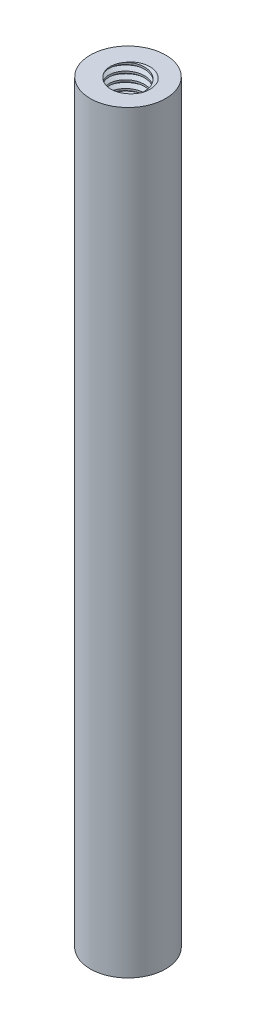
from build123d import *

# Parameters (mm, degrees)
SKETCH1_R           = 3.5
BOSS_EXTRUDE1_DEPTH = 35
SKETCH2_R           = 1.65
CUT_EXTRUDE1_DEPTH  = 6.5
THREAD1_PITCH       = 0.7
THREAD2_PITCH       = 0.7


with BuildPart() as part:
    # Sketch1 → Boss-Extrude1 (new, symmetric)
    with BuildSketch(Plane(origin=(0, 0, 0), x_dir=(1, 0, 0), z_dir=(0, 1, 0))):
        with Locations(Location((0, 0, 0), (0, 0, 270))):
            Circle(SKETCH1_R)
    extrude(amount=BOSS_EXTRUDE1_DEPTH, both=True)

    # Sketch2 → Cut-Extrude1 (cut)
    with BuildSketch(Plane(origin=(0, 35, 0), x_dir=(1, 0, 0), z_dir=(0, 1, 0))):
        with Locations(Location((0, 0, 0), (0, 0, 270))):
            Circle(SKETCH2_R)
    cut_extrude1 = extrude(amount=-CUT_EXTRUDE1_DEPTH, mode=Mode.SUBTRACT)

    # Thread1: the profile of Thread Profile1 profile screwed along a right-hand helix of 11.428571 turns, 6 arcs to a turn; built about Z, then put on its axis
    thread1_z = Axis((0, 0, 0), (0, 0, 1))
    thread1_corners = [(1.6497, 0, -0.000173205), (2.028886112, 0, 0.218749999), (2.028886112, 0, 0.306249999), (1.6497, 0, 0.525173203)]
    with BuildLine(mode=Mode.PRIVATE) as thread1_profile:
        Line(thread1_corners[0], thread1_corners[1])
        Line(thread1_corners[1], thread1_corners[2])
        Line(thread1_corners[2], thread1_corners[3])
        Line(thread1_corners[3], thread1_corners[0])
    thread1_cap = Face(thread1_profile.wire())
    thread1_turn_angles = [0, 30, 60, 90, 120, 150, 180, 210, 240, 270, 300, 330, 360]
    thread1_turn_weights = [1, 0.8660254037844387, 1, 0.8660254037844387, 1, 0.8660254037844387, 1, 0.8660254037844387, 1, 0.8660254037844387, 1, 0.8660254037844387, 1]
    thread1_turn_rails = [Edge.make_bspline([Vector(p[0], p[1], 0).rotate(thread1_z, thread1_turn_angles[k]) / thread1_turn_weights[k] + Vector(0, 0, p[2] + THREAD1_PITCH * thread1_turn_angles[k] / 360) for k in range(13)], [0, 0, 0, 1, 1, 2, 2, 3, 3, 4, 4, 5, 5, 6, 6, 6], 2, thread1_turn_weights) for p in thread1_corners]
    thread1_turn_sides = [Face.make_surface_from_curves(thread1_turn_rails[p[0]], thread1_turn_rails[p[1]]) for p in [(0, 1), (1, 2), (2, 3), (3, 0)]]
    thread1_last_angles = [3960, 3990, 4020, 4050, 4080, 4097.142857143, 4114.285714286]
    thread1_last_weights = [1, 0.8660254037844387, 1, 0.8660254037844387, 1, 0.9555728057861397, 1]
    thread1_last_rails = [Edge.make_bspline([Vector(p[0], p[1], 0).rotate(thread1_z, thread1_last_angles[k]) / thread1_last_weights[k] + Vector(0, 0, p[2] + THREAD1_PITCH * thread1_last_angles[k] / 360) for k in range(7)], [0, 0, 0, 1, 1, 2, 2, 3, 3, 3], 2, thread1_last_weights) for p in thread1_corners]
    thread1_last_sides = [Face.make_surface_from_curves(thread1_last_rails[p[0]], thread1_last_rails[p[1]]) for p in [(0, 1), (1, 2), (2, 3), (3, 0)]]
    thread1 = Plane(origin=(0, 37, 0), x_dir=(-1, 0, 0), z_dir=(0, -1, 0)) * Solid(Shell([*[p.moved(Location((0, 0, THREAD1_PITCH * i))) for i in range(11) for p in thread1_turn_sides], *thread1_last_sides, thread1_cap, thread1_cap.rotate(thread1_z, 4114.285714286).moved(Location((0, 0, THREAD1_PITCH * 4114.285714286 / 360)))]))
    add(thread1, mode=Mode.SUBTRACT)

    # Mirror3: Cut-Extrude1 across plane
    add(cut_extrude1.mirror(Plane.ZX), mode=Mode.SUBTRACT)

    # Thread2: the profile of Thread Profile2 profile screwed along a right-hand helix of 11.428571 turns, 6 arcs to a turn; built about Z, then put on its axis
    thread2_z = Axis((0, 0, 0), (0, 0, 1))
    thread2_corners = [(1.6497, 0, -0.000173205), (2.028886112, 0, 0.218749999), (2.028886112, 0, 0.306249999), (1.6497, 0, 0.525173203)]
    with BuildLine(mode=Mode.PRIVATE) as thread2_profile:
        Line(thread2_corners[0], thread2_corners[1])
        Line(thread2_corners[1], thread2_corners[2])
        Line(thread2_corners[2], thread2_corners[3])
        Line(thread2_corners[3], thread2_corners[0])
    thread2_cap = Face(thread2_profile.wire())
    thread2_turn_angles = [0, 30, 60, 90, 120, 150, 180, 210, 240, 270, 300, 330, 360]
    thread2_turn_weights = [1, 0.8660254037844387, 1, 0.8660254037844387, 1, 0.8660254037844387, 1, 0.8660254037844387, 1, 0.8660254037844387, 1, 0.8660254037844387, 1]
    thread2_turn_rails = [Edge.make_bspline([Vector(p[0], p[1], 0).rotate(thread2_z, thread2_turn_angles[k]) / thread2_turn_weights[k] + Vector(0, 0, p[2] + THREAD2_PITCH * thread2_turn_angles[k] / 360) for k in range(13)], [0, 0, 0, 1, 1, 2, 2, 3, 3, 4, 4, 5, 5, 6, 6, 6], 2, thread2_turn_weights) for p in thread2_corners]
    thread2_turn_sides = [Face.make_surface_from_curves(thread2_turn_rails[p[0]], thread2_turn_rails[p[1]]) for p in [(0, 1), (1, 2), (2, 3), (3, 0)]]
    thread2_last_angles = [3960, 3990, 4020, 4050, 4080, 4097.142857143, 4114.285714286]
    thread2_last_weights = [1, 0.8660254037844387, 1, 0.8660254037844387, 1, 0.9555728057861397, 1]
    thread2_last_rails = [Edge.make_bspline([Vector(p[0], p[1], 0).rotate(thread2_z, thread2_last_angles[k]) / thread2_last_weights[k] + Vector(0, 0, p[2] + THREAD2_PITCH * thread2_last_angles[k] / 360) for k in range(7)], [0, 0, 0, 1, 1, 2, 2, 3, 3, 3], 2, thread2_last_weights) for p in thread2_corners]
    thread2_last_sides = [Face.make_surface_from_curves(thread2_last_rails[p[0]], thread2_last_rails[p[1]]) for p in [(0, 1), (1, 2), (2, 3), (3, 0)]]
    thread2 = Plane(origin=(0, -37, 0), x_dir=(1, 0, 0), z_dir=(0, 1, 0)) * Solid(Shell([*[p.moved(Location((0, 0, THREAD2_PITCH * i))) for i in range(11) for p in thread2_turn_sides], *thread2_last_sides, thread2_cap, thread2_cap.rotate(thread2_z, 4114.285714286).moved(Location((0, 0, THREAD2_PITCH * 4114.285714286 / 360)))]))
    add(thread2, mode=Mode.SUBTRACT)


solid = part.part
